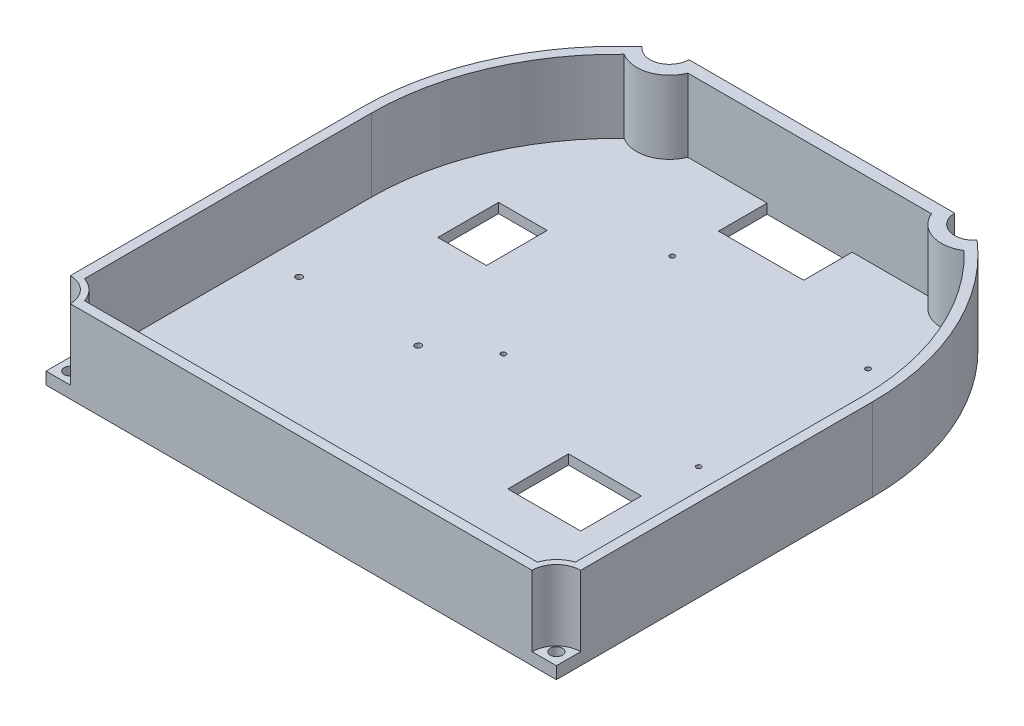
from build123d import *

# Parameters (mm, degrees)
BOSS_EXTRUDE1_DEPTH = 4
BOSS_EXTRUDE2_DEPTH = 30
SKETCH3_W           = 218.358496247
SKETCH3_H           = 47.347449782
CUT_EXTRUDE1_DEPTH  = 317.987381452
BOSS_EXTRUDE3_START = -30
BOSS_EXTRUDE3_DEPTH = 30
BOSS_EXTRUDE4_START = -30
BOSS_EXTRUDE4_DEPTH = 30
CUT_EXTRUDE2_REACH  = 303.911
SKETCH6_R           = 2.5
SKETCH7_R           = 8
CUT_EXTRUDE3_DEPTH  = 29
BOSS_EXTRUDE5_START = -30
BOSS_EXTRUDE5_DEPTH = 30
SKETCH9_R           = 2.5
CUT_EXTRUDE4_DEPTH  = 302.911399089
SKETCH10_R          = 10
CUT_EXTRUDE5_DEPTH  = 29
SKETCH11_W          = 40
SKETCH11_H          = 17
CUT_EXTRUDE6_DEPTH  = 32
SKETCH14_R          = 1.3
CUT_EXTRUDE9_DEPTH  = 10
SKETCH12_R          = 1
CUT_EXTRUDE10_DEPTH = 302.487135546
SKETCH16_W          = 35
SKETCH16_H          = 20
SKETCH16_W_2        = 20
SKETCH16_H_2        = 25
SKETCH16_W_3        = 30
SKETCH16_W_4        = 15
CUT_EXTRUDE11_DEPTH = 302.487135546


# Read off the part's stored shape, not the designer's step: Boss-Extrude3, Boss-Extrude4, Boss-Extrude5
with BuildPart() as part:
    # Sketch1 → Boss-Extrude1 (new body)
    with BuildSketch(Plane(origin=(0, 0, 0), x_dir=(1, 0, 0), z_dir=(0, 1, 0))):
        with BuildLine():
            ThreePointArc((210, 130), (105, 235), (0, 130))
            Line((0, 130), (210, 130))
        make_face()
        with BuildLine():
            Line((210, 130), (0, 130))
            ThreePointArc((0, 130), (105, 25), (210, 130))
        make_face()
        with BuildLine():
            Line((0, 130), (0, 0))
            Line((0, 0), (210, 0))
            Line((210, 0), (210, 130))
            ThreePointArc((210, 130), (105, 25), (0, 130))
        make_face()
    extrude(amount=BOSS_EXTRUDE1_DEPTH)

    # Sketch2 → Boss-Extrude2 (add)
    with BuildSketch(Plane(origin=(0, 4, 0), x_dir=(1, 0, 0), z_dir=(0, 1, 0))):
        with BuildLine():
            Line((210, 0), (210, 130))
            ThreePointArc((210, 130), (105, 235), (0, 130))
            Line((0, 130), (0, 0))
            Line((0, 0), (210, 0))
        make_face()
        with BuildLine():
            ThreePointArc((4, 130), (105, 231), (206, 130))
            Line((206, 130), (206, 4))
            Line((206, 4), (4, 4))
            Line((4, 4), (4, 130))
        make_face(mode=Mode.SUBTRACT)
    extrude(amount=BOSS_EXTRUDE2_DEPTH)

    # Sketch3 → Cut-Extrude1 (cut, through all)
    with BuildSketch(Plane(origin=(0, 34, 0), x_dir=(1, 0, 0), z_dir=(0, 1, 0))):
        with Locations((109.179248124, 237.903724891)):
            Rectangle(SKETCH3_W, SKETCH3_H)
    extrude(amount=-CUT_EXTRUDE1_DEPTH, mode=Mode.SUBTRACT)

    # Boss-Extrude3 outline → Boss-Extrude3 (add)
    with BuildSketch(Plane(origin=(0, 34, 0), x_dir=(1, 0, 0), z_dir=(0, 1, 0)).offset(BOSS_EXTRUDE3_START)):
        with BuildLine():
            Line((160.734254279, 214.23), (49.265745721, 214.23))
            ThreePointArc((49.265745721, 214.23), (45.760745723, 211.802877411), (42.361297108, 209.23))
            Line((42.361297108, 209.23), (167.638702892, 209.23))
            ThreePointArc((167.638702892, 209.23), (164.239254277, 211.802877411), (160.734254279, 214.23))
        make_face()
    extrude(amount=BOSS_EXTRUDE3_DEPTH)

    # Boss-Extrude4 outline → Boss-Extrude4 (add)
    with BuildSketch(Plane(origin=(0, 34, 0), x_dir=(1, 0, 0), z_dir=(0, 1, 0)).offset(BOSS_EXTRUDE4_START)):
        with BuildLine():
            ThreePointArc((42.361297108, 209.23), (38.626128036, 206.128241281), (35.044335216, 202.850565986))
            ThreePointArc((35.044335216, 202.850565986), (46.447220251, 201.380271613), (54.847774812, 209.23))
            Line((54.847774812, 209.23), (42.361297108, 209.23))
        make_face()
        with BuildLine():
            Line((167.638702892, 209.23), (155.152225188, 209.23))
            ThreePointArc((155.152225188, 209.23), (163.552779749, 201.380271613), (174.955664785, 202.850565987))
            ThreePointArc((174.955664785, 202.850565987), (171.373871964, 206.128241281), (167.638702892, 209.23))
        make_face()
    extrude(amount=BOSS_EXTRUDE4_DEPTH)

    # Sketch6 → Cut-Extrude2 (cut, up to next)
    with BuildSketch(Plane(origin=(0, 34, 0), x_dir=(1, 0, 0), z_dir=(0, 1, 0)), mode=Mode.PRIVATE) as cut_extrude2_sk1:
        with Locations(Location((43.986828471, 209.23, 0), (0, 0, 270))):
            Circle(SKETCH6_R)
    cut_extrude2_tool1 = extrude(cut_extrude2_sk1.sketch, amount=-CUT_EXTRUDE2_REACH, mode=Mode.PRIVATE) & part.part
    # Sketch6 → Cut-Extrude2 (cut, up to next)
    with BuildSketch(Plane(origin=(0, 34, 0), x_dir=(1, 0, 0), z_dir=(0, 1, 0)), mode=Mode.PRIVATE) as cut_extrude2_sk2:
        with Locations(Location((166.013171529, 209.23, 0), (0, 0, 270))):
            Circle(SKETCH6_R)
    cut_extrude2_tool2 = extrude(cut_extrude2_sk2.sketch, amount=-CUT_EXTRUDE2_REACH, mode=Mode.PRIVATE) & part.part
    add(cut_extrude2_tool1.solids().sort_by_distance((43.986828, 34, -209.23))[0], mode=Mode.SUBTRACT)
    add(cut_extrude2_tool2.solids().sort_by_distance((166.013172, 34, -209.23))[0], mode=Mode.SUBTRACT)

    # Sketch7 → Cut-Extrude3 (cut)
    with BuildSketch(Plane(origin=(0, 34, 0), x_dir=(1, 0, 0), z_dir=(0, 1, 0))):
        with Locations((42.307838608, 214.23)):
            Circle(SKETCH7_R)
        with Locations((167.692161392, 214.23)):
            Circle(SKETCH7_R)
    extrude(amount=-CUT_EXTRUDE3_DEPTH, mode=Mode.SUBTRACT)

    # Boss-Extrude5 outline → Boss-Extrude5 (add)
    with BuildSketch(Plane(origin=(0, 34, 0), x_dir=(1, 0, 0), z_dir=(0, 1, 0)).offset(BOSS_EXTRUDE5_START)):
        with BuildLine():
            Line((4, 4), (11.842719282, 4))
            ThreePointArc((11.842719282, 4), (8.838834765, 8.838834765), (4, 11.842719282))
            Line((4, 11.842719282), (4, 4))
        make_face()
        with BuildLine():
            ThreePointArc((206, 11.842719282), (201.161165235, 8.838834765), (198.157280718, 4))
            Line((198.157280718, 4), (206, 4))
            Line((206, 4), (206, 11.842719282))
        make_face()
    extrude(amount=BOSS_EXTRUDE5_DEPTH)

    # Sketch9 → Cut-Extrude4 (cut, through all)
    with BuildSketch(Plane(origin=(0, 34, 0), x_dir=(1, 0, 0), z_dir=(0, 1, 0))):
        with Locations(Location((5, 5, 0), (0, 0, 270))):
            Circle(SKETCH9_R)
        with Locations(Location((205, 5, 0), (0, 0, 270))):
            Circle(SKETCH9_R)
    extrude(amount=-CUT_EXTRUDE4_DEPTH, mode=Mode.SUBTRACT)

    # Sketch10 → Cut-Extrude5 (cut)
    with BuildSketch(Plane(origin=(0, 34, 0), x_dir=(1, 0, 0), z_dir=(0, 1, 0))):
        Circle(SKETCH10_R)
        with Locations((210, 0)):
            Circle(SKETCH10_R)
    extrude(amount=-CUT_EXTRUDE5_DEPTH, mode=Mode.SUBTRACT)

    # Sketch11 → Cut-Extrude6 (cut)
    with BuildSketch(Plane(origin=(0, 4, 0), x_dir=(1, 0, 0), z_dir=(0, 1, 0))):
        with Locations((105, 12.5)):
            Rectangle(SKETCH11_W, SKETCH11_H)
    extrude(amount=-CUT_EXTRUDE6_DEPTH, mode=Mode.SUBTRACT)

    # Sketch14 → Cut-Extrude9 (cut)
    with BuildSketch(Plane(origin=(0, 4, 0), x_dir=(1, 0, 0), z_dir=(0, 1, 0))):
        with Locations(Location((17.5, 86.643431732, 0), (0, 0, 270))):
            Circle(SKETCH14_R)
        with Locations(Location((66.5, 86.643431732, 0), (0, 0, 270))):
            Circle(SKETCH14_R)
        with Locations(Location((17.5, 28.643431732, 0), (0, 0, 270))):
            Circle(SKETCH14_R)
        with Locations(Location((66.5, 28.643431732, 0), (0, 0, 270))):
            Circle(SKETCH14_R)
    extrude(amount=-CUT_EXTRUDE9_DEPTH, mode=Mode.SUBTRACT)

    # Sketch12 → Cut-Extrude10 (cut, through all)
    with BuildSketch(Plane(origin=(0, 4, 0), x_dir=(1, 0, 0), z_dir=(0, 1, 0))):
        with Locations(Location((86.9, 170.810842956, 0), (0, 0, 270))):
            Circle(SKETCH12_R)
        with Locations(Location((167.35, 101.210842956, 0), (0, 0, 270))):
            Circle(SKETCH12_R)
        with Locations(Location((167.35, 170.910842956, 0), (0, 0, 270))):
            Circle(SKETCH12_R)
        with Locations(Location((87, 101.210842956, 0), (0, 0, 270))):
            Circle(SKETCH12_R)
    extrude(amount=-CUT_EXTRUDE10_DEPTH, mode=Mode.SUBTRACT)

    # Sketch16 → Cut-Extrude11 (cut, through all)
    with BuildSketch(Plane(origin=(0, 4, 0), x_dir=(1, 0, 0), z_dir=(0, 1, 0))):
        with Locations((105, 199.23)):
            Rectangle(SKETCH16_W, SKETCH16_H)
        with Locations((42, 141.73)):
            Rectangle(SKETCH16_W_2, SKETCH16_H_2)
        with Locations((151, 66.5)):
            Rectangle(SKETCH16_W_3, SKETCH16_H_2)
        with Locations((191, 136.73)):
            Rectangle(SKETCH16_W_4, SKETCH16_H_2)
    extrude(amount=-CUT_EXTRUDE11_DEPTH, mode=Mode.SUBTRACT)


solid = part.part
